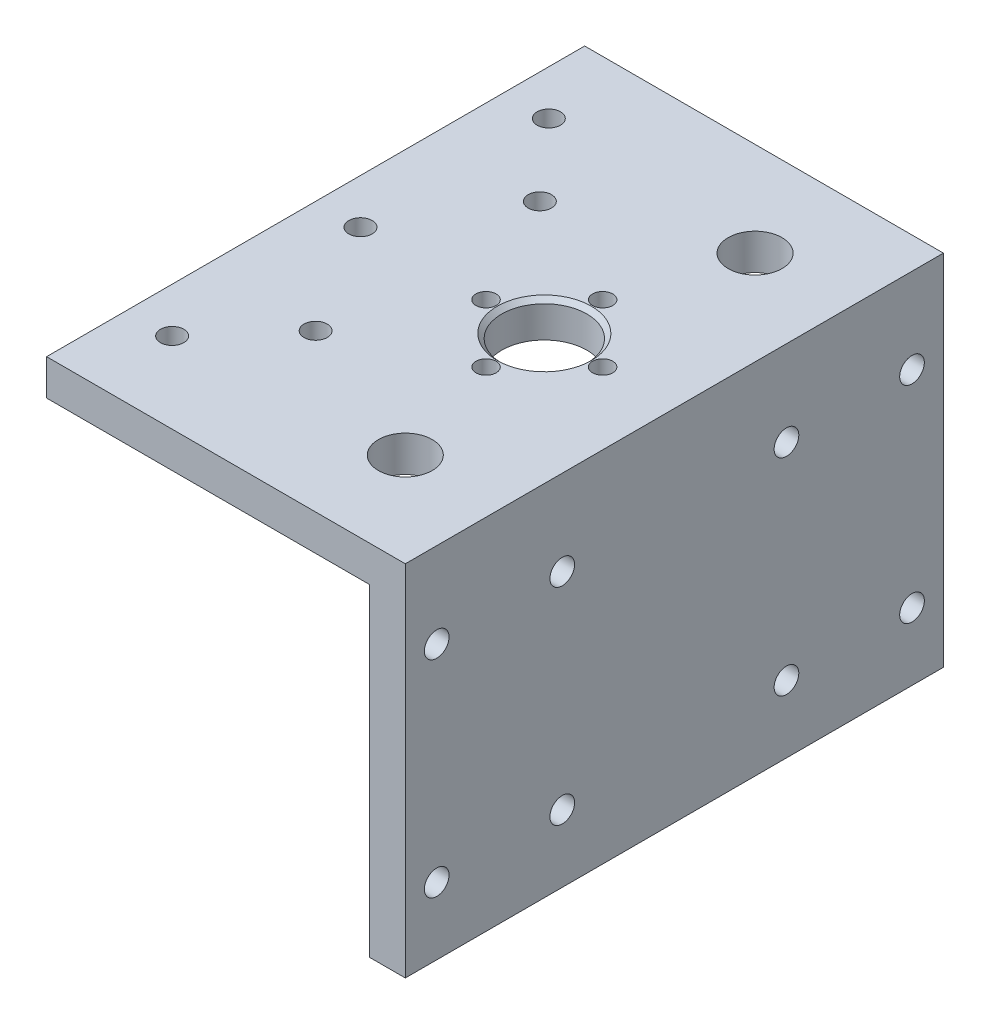
from build123d import *

# Parameters (mm, degrees)
ESTRUSIONE_ESTRUSIONE1_DEPTH = 120
TAGLIO_ESTRUSIONE2_REACH     = 166.924
SCHIZZO6_R                   = 6
TAGLIO_ESTRUSIONE3_REACH     = 166.924
SCHIZZO7_R                   = 9.5
FORO_PER_VITE_M4_2_D         = 4.5
SCHIZZO12_R                  = 2.75
TAGLIO_ESTRUSIONE4_DEPTH     = 10
SCHIZZO14_R                  = 2.6
TAGLIO_ESTRUSIONE5_DEPTH     = 10
SMUSSO2_SIZE                 = 1


with BuildPart() as part:
    # Schizzo1 → Estrusione-Estrusione1 (new body)
    with BuildSketch(Plane.XY):
        Polygon((0, 0), (-80, 0), (-80, -8), (-8, -8), (-8, -80), (0, -80), align=None)
    extrude(amount=ESTRUSIONE_ESTRUSIONE1_DEPTH)

    # Schizzo6 → Taglio-Estrusione2 (cut, up to next)
    with BuildSketch(Plane(origin=(0, 0, 0), x_dir=(1, 0, 0), z_dir=(0, 1, 0)), mode=Mode.PRIVATE) as taglio_estrusione2_sk1:
        with Locations((-21, -21)):
            Circle(SCHIZZO6_R)
    taglio_estrusione2_tool1 = extrude(taglio_estrusione2_sk1.sketch, amount=-TAGLIO_ESTRUSIONE2_REACH, mode=Mode.PRIVATE) & part.part
    # Schizzo6 → Taglio-Estrusione2 (cut, up to next)
    with BuildSketch(Plane(origin=(0, 0, 0), x_dir=(1, 0, 0), z_dir=(0, 1, 0)), mode=Mode.PRIVATE) as taglio_estrusione2_sk2:
        with Locations((-21, -99)):
            Circle(SCHIZZO6_R)
    taglio_estrusione2_tool2 = extrude(taglio_estrusione2_sk2.sketch, amount=-TAGLIO_ESTRUSIONE2_REACH, mode=Mode.PRIVATE) & part.part
    add(taglio_estrusione2_tool1.solids().sort_by_distance((-21, 0, 21))[0], mode=Mode.SUBTRACT)
    add(taglio_estrusione2_tool2.solids().sort_by_distance((-21, 0, 99))[0], mode=Mode.SUBTRACT)

    # Schizzo7 → Taglio-Estrusione3 (cut, up to next)
    with BuildSketch(Plane(origin=(0, 0, 0), x_dir=(1, 0, 0), z_dir=(0, 1, 0)), mode=Mode.PRIVATE) as taglio_estrusione3_sk1:
        with Locations((-29, -60)):
            Circle(SCHIZZO7_R)
    taglio_estrusione3_tool1 = extrude(taglio_estrusione3_sk1.sketch, amount=-TAGLIO_ESTRUSIONE3_REACH, mode=Mode.PRIVATE) & part.part
    add(taglio_estrusione3_tool1.solids().sort_by_distance((-29, 0, 60))[0], mode=Mode.SUBTRACT)

    # Foro per Vite M4-2 (through all)
    with Locations(Plane(origin=(0, 0, 0), x_dir=(1, 0, 0), z_dir=(0, 1, 0))):
        with Locations((-29, -47), (-42, -60), (-29, -73), (-16, -60), (-29, -60)):
            Hole(FORO_PER_VITE_M4_2_D / 2)

    # Schizzo12 → Taglio-Estrusione4 (cut)
    with BuildSketch(Plane(origin=(0, 0, 0), x_dir=(0, 0, -1), z_dir=(1, 0, 0))):
        with Locations((-113, -19)):
            Circle(SCHIZZO12_R)
        with Locations((-85, -19)):
            Circle(SCHIZZO12_R)
        with Locations((-35, -19)):
            Circle(SCHIZZO12_R)
        with Locations((-7, -19)):
            Circle(SCHIZZO12_R)
        with Locations((-85, -65)):
            Circle(SCHIZZO12_R)
        with Locations((-113, -65)):
            Circle(SCHIZZO12_R)
        with Locations((-7, -65)):
            Circle(SCHIZZO12_R)
        with Locations((-35, -65)):
            Circle(SCHIZZO12_R)
    extrude(amount=-TAGLIO_ESTRUSIONE4_DEPTH, mode=Mode.SUBTRACT)

    # Schizzo14 → Taglio-Estrusione5 (cut)
    with BuildSketch(Plane(origin=(0, 0, 0), x_dir=(1, 0, 0), z_dir=(0, 1, 0))):
        with Locations((-70, -18)):
            Circle(SCHIZZO14_R)
        with Locations((-70, -60)):
            Circle(SCHIZZO14_R)
        with Locations((-70, -102)):
            Circle(SCHIZZO14_R)
        with Locations((-55, -35)):
            Circle(SCHIZZO14_R)
        with Locations((-55, -85)):
            Circle(SCHIZZO14_R)
    extrude(amount=-TAGLIO_ESTRUSIONE5_DEPTH, mode=Mode.SUBTRACT)

    # Smusso2
    smusso2_edges = [part.edges().sort_by_distance(p)[0] for p in [
        (-38.5, 0, 60),
    ]]
    chamfer(smusso2_edges, length=SMUSSO2_SIZE)


solid = part.part
